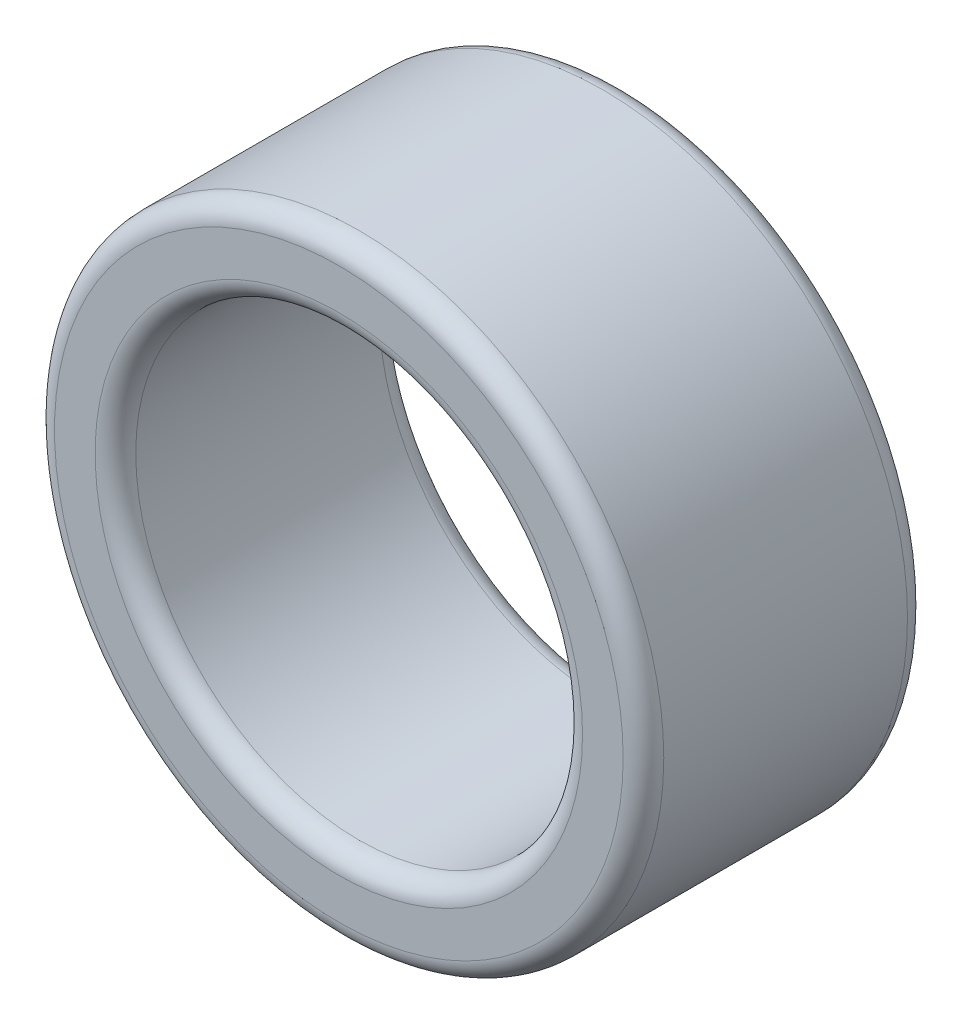
from build123d import *

# Parameters (mm, degrees)
SKETCH2_R           = 381
BOSS_EXTRUDE1_DEPTH = 355.6
SKETCH3_R           = 279.4
CUT_EXTRUDE1_DEPTH  = 646.579863379
FILLET3_R           = 25.4
FILLET4_R           = 25.4


with BuildPart() as part:
    # Sketch2 → Boss-Extrude1 (new body)
    with BuildSketch(Plane.XY):
        Circle(SKETCH2_R)
    extrude(amount=BOSS_EXTRUDE1_DEPTH)

    # Sketch3 → Cut-Extrude1 (cut, through all)
    with BuildSketch(Plane.XY.offset(355.6)):
        Circle(SKETCH3_R)
    extrude(amount=-CUT_EXTRUDE1_DEPTH, mode=Mode.SUBTRACT)

    # Fillet3
    fillet3_edges = [part.edges().sort_by_distance(p)[0] for p in [
        (-381, 0, 0),
        (-381, 0, 355.6),
    ]]
    fillet(fillet3_edges, radius=FILLET3_R)

    # Fillet4
    fillet4_edges = [part.edges().sort_by_distance(p)[0] for p in [
        (-279.4, 0, 0),
        (-279.4, 0, 355.6),
    ]]
    fillet(fillet4_edges, radius=FILLET4_R)


solid = part.part
